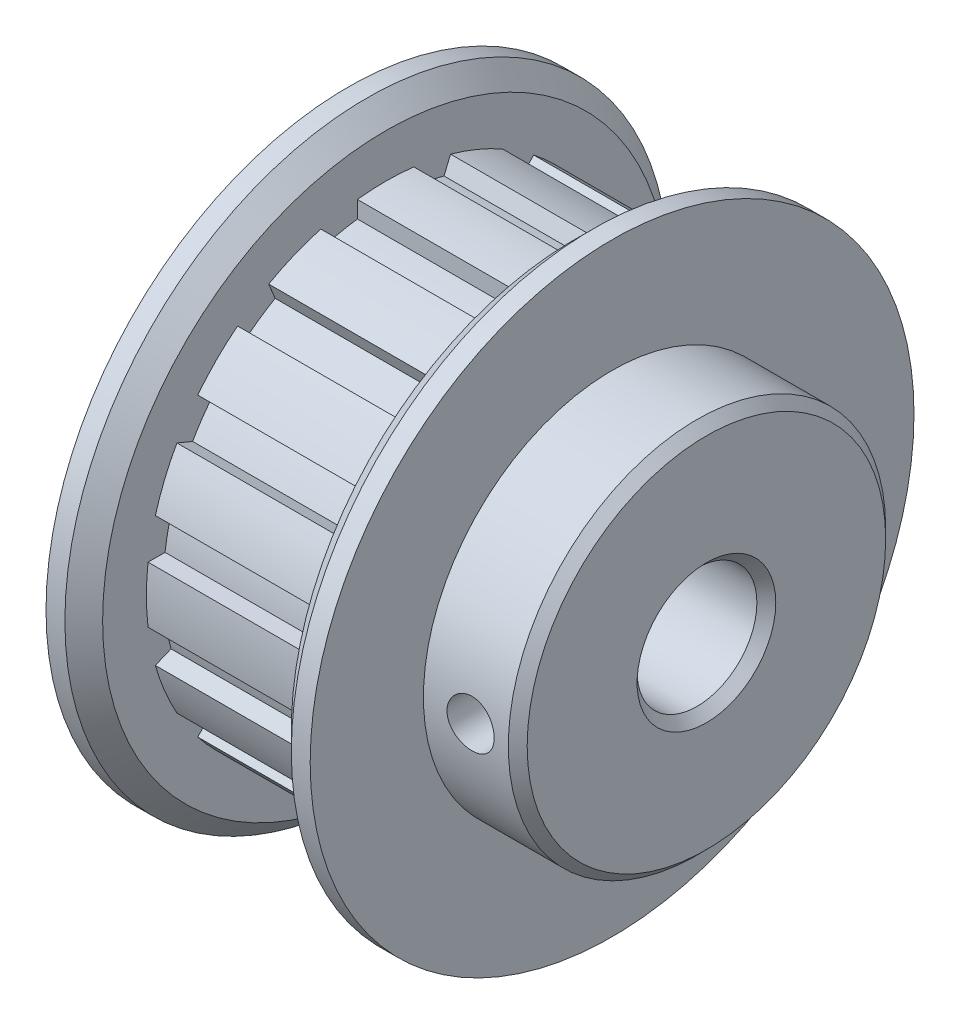
from build123d import *

# Parameters (mm, degrees)
BOSS_EXTRUDE1_START       = -13
BOSS_EXTRUDE1_DEPTH       = 14
BOSS_EXTRUDE1_START_2     = -25
BOSS_EXTRUDE1_2_OUTLINE_R = 9
BOSS_EXTRUDE1_2_DEPTH     = 12
BOSS_EXTRUDE1_START_3     = -1
BOSS_EXTRUDE1_3_OUTLINE_R = 16
BOSS_EXTRUDE1_3_DEPTH     = 2
BOSS_EXTRUDE1_4_OUTLINE_R = 14.25
BOSS_EXTRUDE1_4_DEPTH     = 0.9999999
SKETCH2_R                 = 9
CUT_EXTRUDE1_DEPTH        = 7
SKETCH3_R                 = 10
BOSS_EXTRUDE2_DEPTH       = 5
SKETCH8_R                 = 16
BOSS_EXTRUDE3_DEPTH       = 2
CHAMFER1_SIZE             = 1
SKETCH4_R                 = 3.175
CUT_EXTRUDE2_DEPTH        = 30.546573405
CHAMFER2_SIZE             = 0.5
SKETCH7_W                 = 1.25
SKETCH7_H                 = 16


with BuildPart() as part:
    # Boss-Extrude1: read off the stored shape, not the designer's step
    # Boss-Extrude1 outline → Boss-Extrude1 (new body)
    with BuildSketch(Plane.ZY.offset(BOSS_EXTRUDE1_START)):
        with BuildLine():
            ThreePointArc((-1.493827307, 11.692460658), (-2.299627171, 11.561006493), (-3.094394503, 11.374088047))
            Line((-3.094394503, 11.374088047), (-3.438518062, 12.20487581))
            ThreePointArc((-3.438518062, 12.20487581), (-4.852425922, 11.714792472), (-6.19875101, 11.061549888))
            Line((-6.19875101, 11.061549888), (-5.854627451, 10.230762125))
            ThreePointArc((-5.854627451, 10.230762125), (-6.548784122, 9.800948055), (-7.211522801, 9.324113638))
            Line((-7.211522801, 9.324113638), (-7.847380226, 9.959971063))
            ThreePointArc((-7.847380226, 9.959971063), (-8.966113985, 8.966113985), (-9.959971063, 7.847380226))
            Line((-9.959971063, 7.847380226), (-9.324113638, 7.211522801))
            ThreePointArc((-9.324113638, 7.211522801), (-9.800948055, 6.548784122), (-10.230762125, 5.854627451))
            Line((-10.230762125, 5.854627451), (-11.061549888, 6.19875101))
            ThreePointArc((-11.061549888, 6.19875101), (-11.714792472, 4.852425922), (-12.20487581, 3.438518062))
            Line((-12.20487581, 3.438518062), (-11.374088047, 3.094394503))
            ThreePointArc((-11.374088047, 3.094394503), (-11.561006493, 2.299627171), (-11.692460658, 1.493827307))
            Line((-11.692460658, 1.493827307), (-12.591698852, 1.493827307))
            ThreePointArc((-12.591698852, 1.493827307), (-12.68, 0), (-12.591698852, -1.493827307))
            Line((-12.591698852, -1.493827307), (-11.692460658, -1.493827307))
            ThreePointArc((-11.692460658, -1.493827307), (-11.561006493, -2.299627171), (-11.374088047, -3.094394503))
            Line((-11.374088047, -3.094394503), (-12.20487581, -3.438518062))
            ThreePointArc((-12.20487581, -3.438518062), (-11.714792472, -4.852425922), (-11.061549888, -6.19875101))
            Line((-11.061549888, -6.19875101), (-10.230762125, -5.854627451))
            ThreePointArc((-10.230762125, -5.854627451), (-9.800948055, -6.548784122), (-9.324113638, -7.211522801))
            Line((-9.324113638, -7.211522801), (-9.959971063, -7.847380226))
            ThreePointArc((-9.959971063, -7.847380226), (-8.966113985, -8.966113985), (-7.847380226, -9.959971063))
            Line((-7.847380226, -9.959971063), (-7.211522801, -9.324113638))
            ThreePointArc((-7.211522801, -9.324113638), (-6.548784122, -9.800948055), (-5.854627451, -10.230762125))
            Line((-5.854627451, -10.230762125), (-6.19875101, -11.061549888))
            ThreePointArc((-6.19875101, -11.061549888), (-4.852425922, -11.714792472), (-3.438518062, -12.20487581))
            Line((-3.438518062, -12.20487581), (-3.094394503, -11.374088047))
            ThreePointArc((-3.094394503, -11.374088047), (-2.299627171, -11.561006493), (-1.493827307, -11.692460658))
            Line((-1.493827307, -11.692460658), (-1.493827307, -12.591698852))
            ThreePointArc((-1.493827307, -12.591698852), (0, -12.68), (1.493827307, -12.591698852))
            Line((1.493827307, -12.591698852), (1.493827307, -11.692460658))
            ThreePointArc((1.493827307, -11.692460658), (2.299627171, -11.561006493), (3.094394503, -11.374088047))
            Line((3.094394503, -11.374088047), (3.438518062, -12.20487581))
            ThreePointArc((3.438518062, -12.20487581), (4.852425922, -11.714792472), (6.19875101, -11.061549888))
            Line((6.19875101, -11.061549888), (5.854627451, -10.230762125))
            ThreePointArc((5.854627451, -10.230762125), (6.548784122, -9.800948055), (7.211522801, -9.324113638))
            Line((7.211522801, -9.324113638), (7.847380226, -9.959971063))
            ThreePointArc((7.847380226, -9.959971063), (8.966113985, -8.966113985), (9.959971063, -7.847380226))
            Line((9.959971063, -7.847380226), (9.324113638, -7.211522801))
            ThreePointArc((9.324113638, -7.211522801), (9.800948055, -6.548784122), (10.230762125, -5.854627451))
            Line((10.230762125, -5.854627451), (11.061549888, -6.19875101))
            ThreePointArc((11.061549888, -6.19875101), (11.714792472, -4.852425922), (12.20487581, -3.438518062))
            Line((12.20487581, -3.438518062), (11.374088047, -3.094394503))
            ThreePointArc((11.374088047, -3.094394503), (11.561006493, -2.299627171), (11.692460658, -1.493827307))
            Line((11.692460658, -1.493827307), (12.591698852, -1.493827307))
            ThreePointArc((12.591698852, -1.493827307), (12.68, 0), (12.591698852, 1.493827307))
            Line((12.591698852, 1.493827307), (11.692460658, 1.493827307))
            ThreePointArc((11.692460658, 1.493827307), (11.561006493, 2.299627171), (11.374088047, 3.094394503))
            Line((11.374088047, 3.094394503), (12.20487581, 3.438518062))
            ThreePointArc((12.20487581, 3.438518062), (11.714792472, 4.852425922), (11.061549888, 6.19875101))
            Line((11.061549888, 6.19875101), (10.230762125, 5.854627451))
            ThreePointArc((10.230762125, 5.854627451), (9.800948055, 6.548784122), (9.324113638, 7.211522801))
            Line((9.324113638, 7.211522801), (9.959971063, 7.847380226))
            ThreePointArc((9.959971063, 7.847380226), (8.966113985, 8.966113985), (7.847380226, 9.959971063))
            Line((7.847380226, 9.959971063), (7.211522801, 9.324113638))
            ThreePointArc((7.211522801, 9.324113638), (6.548784122, 9.800948055), (5.854627451, 10.230762125))
            Line((5.854627451, 10.230762125), (6.19875101, 11.061549888))
            ThreePointArc((6.19875101, 11.061549888), (4.852425922, 11.714792472), (3.438518062, 12.20487581))
            Line((3.438518062, 12.20487581), (3.094394503, 11.374088047))
            ThreePointArc((3.094394503, 11.374088047), (2.299627171, 11.561006493), (1.493827307, 11.692460658))
            Line((1.493827307, 11.692460658), (1.493827307, 12.591698852))
            ThreePointArc((1.493827307, 12.591698852), (0, 12.68), (-1.493827307, 12.591698852))
            Line((-1.493827307, 12.591698852), (-1.493827307, 11.692460658))
        make_face()
    extrude(amount=BOSS_EXTRUDE1_DEPTH)

    # Boss-Extrude1 2 outline → Boss-Extrude1 2 (add)
    with BuildSketch(Plane.ZY.offset(BOSS_EXTRUDE1_START_2)):
        Circle(BOSS_EXTRUDE1_2_OUTLINE_R)
    extrude(amount=BOSS_EXTRUDE1_2_DEPTH)

    # Boss-Extrude1 3 outline → Boss-Extrude1 3 (add)
    with BuildSketch(Plane.ZY.offset(BOSS_EXTRUDE1_START_3)):
        Circle(BOSS_EXTRUDE1_3_OUTLINE_R)
        with BuildLine():
            Line((-3.438518062, 12.20487581), (-3.094394503, 11.374088047))
            ThreePointArc((-3.094394503, 11.374088047), (-2.299627171, 11.561006493), (-1.493827307, 11.692460658))
            Line((-1.493827307, 11.692460658), (-1.493827307, 12.591698852))
            ThreePointArc((-1.493827307, 12.591698852), (0, 12.68), (1.493827307, 12.591698852))
            Line((1.493827307, 12.591698852), (1.493827307, 11.692460658))
            ThreePointArc((1.493827307, 11.692460658), (2.299627171, 11.561006493), (3.094394503, 11.374088047))
            Line((3.094394503, 11.374088047), (3.438518062, 12.20487581))
            ThreePointArc((3.438518062, 12.20487581), (4.852425922, 11.714792472), (6.19875101, 11.061549888))
            Line((6.19875101, 11.061549888), (5.854627451, 10.230762125))
            ThreePointArc((5.854627451, 10.230762125), (6.548784122, 9.800948055), (7.211522801, 9.324113638))
            Line((7.211522801, 9.324113638), (7.847380226, 9.959971063))
            ThreePointArc((7.847380226, 9.959971063), (8.966113985, 8.966113985), (9.959971063, 7.847380226))
            Line((9.959971063, 7.847380226), (9.324113638, 7.211522801))
            ThreePointArc((9.324113638, 7.211522801), (9.800948055, 6.548784122), (10.230762125, 5.854627451))
            Line((10.230762125, 5.854627451), (11.061549888, 6.19875101))
            ThreePointArc((11.061549888, 6.19875101), (11.714792472, 4.852425922), (12.20487581, 3.438518062))
            Line((12.20487581, 3.438518062), (11.374088047, 3.094394503))
            ThreePointArc((11.374088047, 3.094394503), (11.561006493, 2.299627171), (11.692460658, 1.493827307))
            Line((11.692460658, 1.493827307), (12.591698852, 1.493827307))
            ThreePointArc((12.591698852, 1.493827307), (12.68, 0), (12.591698852, -1.493827307))
            Line((12.591698852, -1.493827307), (11.692460658, -1.493827307))
            ThreePointArc((11.692460658, -1.493827307), (11.561006493, -2.299627171), (11.374088047, -3.094394503))
            Line((11.374088047, -3.094394503), (12.20487581, -3.438518062))
            ThreePointArc((12.20487581, -3.438518062), (11.714792472, -4.852425922), (11.061549888, -6.19875101))
            Line((11.061549888, -6.19875101), (10.230762125, -5.854627451))
            ThreePointArc((10.230762125, -5.854627451), (9.800948055, -6.548784122), (9.324113638, -7.211522801))
            Line((9.324113638, -7.211522801), (9.959971063, -7.847380226))
            ThreePointArc((9.959971063, -7.847380226), (8.966113985, -8.966113985), (7.847380226, -9.959971063))
            Line((7.847380226, -9.959971063), (7.211522801, -9.324113638))
            ThreePointArc((7.211522801, -9.324113638), (6.548784122, -9.800948055), (5.854627451, -10.230762125))
            Line((5.854627451, -10.230762125), (6.19875101, -11.061549888))
            ThreePointArc((6.19875101, -11.061549888), (4.852425922, -11.714792472), (3.438518062, -12.20487581))
            Line((3.438518062, -12.20487581), (3.094394503, -11.374088047))
            ThreePointArc((3.094394503, -11.374088047), (2.299627171, -11.561006493), (1.493827307, -11.692460658))
            Line((1.493827307, -11.692460658), (1.493827307, -12.591698852))
            ThreePointArc((1.493827307, -12.591698852), (0, -12.68), (-1.493827307, -12.591698852))
            Line((-1.493827307, -12.591698852), (-1.493827307, -11.692460658))
            ThreePointArc((-1.493827307, -11.692460658), (-2.299627171, -11.561006493), (-3.094394503, -11.374088047))
            Line((-3.094394503, -11.374088047), (-3.438518062, -12.20487581))
            ThreePointArc((-3.438518062, -12.20487581), (-4.852425922, -11.714792472), (-6.19875101, -11.061549888))
            Line((-6.19875101, -11.061549888), (-5.854627451, -10.230762125))
            ThreePointArc((-5.854627451, -10.230762125), (-6.548784122, -9.800948055), (-7.211522801, -9.324113638))
            Line((-7.211522801, -9.324113638), (-7.847380226, -9.959971063))
            ThreePointArc((-7.847380226, -9.959971063), (-8.966113985, -8.966113985), (-9.959971063, -7.847380226))
            Line((-9.959971063, -7.847380226), (-9.324113638, -7.211522801))
            ThreePointArc((-9.324113638, -7.211522801), (-9.800948055, -6.548784122), (-10.230762125, -5.854627451))
            Line((-10.230762125, -5.854627451), (-11.061549888, -6.19875101))
            ThreePointArc((-11.061549888, -6.19875101), (-11.714792472, -4.852425922), (-12.20487581, -3.438518062))
            Line((-12.20487581, -3.438518062), (-11.374088047, -3.094394503))
            ThreePointArc((-11.374088047, -3.094394503), (-11.561006493, -2.299627171), (-11.692460658, -1.493827307))
            Line((-11.692460658, -1.493827307), (-12.591698852, -1.493827307))
            ThreePointArc((-12.591698852, -1.493827307), (-12.68, 0), (-12.591698852, 1.493827307))
            Line((-12.591698852, 1.493827307), (-11.692460658, 1.493827307))
            ThreePointArc((-11.692460658, 1.493827307), (-11.561006493, 2.299627171), (-11.374088047, 3.094394503))
            Line((-11.374088047, 3.094394503), (-12.20487581, 3.438518062))
            ThreePointArc((-12.20487581, 3.438518062), (-11.714792472, 4.852425922), (-11.061549888, 6.19875101))
            Line((-11.061549888, 6.19875101), (-10.230762125, 5.854627451))
            ThreePointArc((-10.230762125, 5.854627451), (-9.800948055, 6.548784122), (-9.324113638, 7.211522801))
            Line((-9.324113638, 7.211522801), (-9.959971063, 7.847380226))
            ThreePointArc((-9.959971063, 7.847380226), (-8.966113985, 8.966113985), (-7.847380226, 9.959971063))
            Line((-7.847380226, 9.959971063), (-7.211522801, 9.324113638))
            ThreePointArc((-7.211522801, 9.324113638), (-6.548784122, 9.800948055), (-5.854627451, 10.230762125))
            Line((-5.854627451, 10.230762125), (-6.19875101, 11.061549888))
            ThreePointArc((-6.19875101, 11.061549888), (-4.852425922, 11.714792472), (-3.438518062, 12.20487581))
        make_face(mode=Mode.SUBTRACT)
    extrude(amount=BOSS_EXTRUDE1_3_DEPTH)

    # Boss-Extrude1 4 outline → Boss-Extrude1 4 (add)
    with BuildSketch(Plane.ZY.offset(BOSS_EXTRUDE1_START)):
        Circle(BOSS_EXTRUDE1_4_OUTLINE_R)
        with BuildLine():
            Line((-3.438518062, 12.20487581), (-3.094394503, 11.374088047))
            ThreePointArc((-3.094394503, 11.374088047), (-2.299627171, 11.561006493), (-1.493827307, 11.692460658))
            Line((-1.493827307, 11.692460658), (-1.493827307, 12.591698852))
            ThreePointArc((-1.493827307, 12.591698852), (0, 12.68), (1.493827307, 12.591698852))
            Line((1.493827307, 12.591698852), (1.493827307, 11.692460658))
            ThreePointArc((1.493827307, 11.692460658), (2.299627171, 11.561006493), (3.094394503, 11.374088047))
            Line((3.094394503, 11.374088047), (3.438518062, 12.20487581))
            ThreePointArc((3.438518062, 12.20487581), (4.852425922, 11.714792472), (6.19875101, 11.061549888))
            Line((6.19875101, 11.061549888), (5.854627451, 10.230762125))
            ThreePointArc((5.854627451, 10.230762125), (6.548784122, 9.800948055), (7.211522801, 9.324113638))
            Line((7.211522801, 9.324113638), (7.847380226, 9.959971063))
            ThreePointArc((7.847380226, 9.959971063), (8.966113985, 8.966113985), (9.959971063, 7.847380226))
            Line((9.959971063, 7.847380226), (9.324113638, 7.211522801))
            ThreePointArc((9.324113638, 7.211522801), (9.800948055, 6.548784122), (10.230762125, 5.854627451))
            Line((10.230762125, 5.854627451), (11.061549888, 6.19875101))
            ThreePointArc((11.061549888, 6.19875101), (11.714792472, 4.852425922), (12.20487581, 3.438518062))
            Line((12.20487581, 3.438518062), (11.374088047, 3.094394503))
            ThreePointArc((11.374088047, 3.094394503), (11.561006493, 2.299627171), (11.692460658, 1.493827307))
            Line((11.692460658, 1.493827307), (12.591698852, 1.493827307))
            ThreePointArc((12.591698852, 1.493827307), (12.68, 0), (12.591698852, -1.493827307))
            Line((12.591698852, -1.493827307), (11.692460658, -1.493827307))
            ThreePointArc((11.692460658, -1.493827307), (11.561006493, -2.299627171), (11.374088047, -3.094394503))
            Line((11.374088047, -3.094394503), (12.20487581, -3.438518062))
            ThreePointArc((12.20487581, -3.438518062), (11.714792472, -4.852425922), (11.061549888, -6.19875101))
            Line((11.061549888, -6.19875101), (10.230762125, -5.854627451))
            ThreePointArc((10.230762125, -5.854627451), (9.800948055, -6.548784122), (9.324113638, -7.211522801))
            Line((9.324113638, -7.211522801), (9.959971063, -7.847380226))
            ThreePointArc((9.959971063, -7.847380226), (8.966113985, -8.966113985), (7.847380226, -9.959971063))
            Line((7.847380226, -9.959971063), (7.211522801, -9.324113638))
            ThreePointArc((7.211522801, -9.324113638), (6.548784122, -9.800948055), (5.854627451, -10.230762125))
            Line((5.854627451, -10.230762125), (6.19875101, -11.061549888))
            ThreePointArc((6.19875101, -11.061549888), (4.852425922, -11.714792472), (3.438518062, -12.20487581))
            Line((3.438518062, -12.20487581), (3.094394503, -11.374088047))
            ThreePointArc((3.094394503, -11.374088047), (2.299627171, -11.561006493), (1.493827307, -11.692460658))
            Line((1.493827307, -11.692460658), (1.493827307, -12.591698852))
            ThreePointArc((1.493827307, -12.591698852), (0, -12.68), (-1.493827307, -12.591698852))
            Line((-1.493827307, -12.591698852), (-1.493827307, -11.692460658))
            ThreePointArc((-1.493827307, -11.692460658), (-2.299627171, -11.561006493), (-3.094394503, -11.374088047))
            Line((-3.094394503, -11.374088047), (-3.438518062, -12.20487581))
            ThreePointArc((-3.438518062, -12.20487581), (-4.852425922, -11.714792472), (-6.19875101, -11.061549888))
            Line((-6.19875101, -11.061549888), (-5.854627451, -10.230762125))
            ThreePointArc((-5.854627451, -10.230762125), (-6.548784122, -9.800948055), (-7.211522801, -9.324113638))
            Line((-7.211522801, -9.324113638), (-7.847380226, -9.959971063))
            ThreePointArc((-7.847380226, -9.959971063), (-8.966113985, -8.966113985), (-9.959971063, -7.847380226))
            Line((-9.959971063, -7.847380226), (-9.324113638, -7.211522801))
            ThreePointArc((-9.324113638, -7.211522801), (-9.800948055, -6.548784122), (-10.230762125, -5.854627451))
            Line((-10.230762125, -5.854627451), (-11.061549888, -6.19875101))
            ThreePointArc((-11.061549888, -6.19875101), (-11.714792472, -4.852425922), (-12.20487581, -3.438518062))
            Line((-12.20487581, -3.438518062), (-11.374088047, -3.094394503))
            ThreePointArc((-11.374088047, -3.094394503), (-11.561006493, -2.299627171), (-11.692460658, -1.493827307))
            Line((-11.692460658, -1.493827307), (-12.591698852, -1.493827307))
            ThreePointArc((-12.591698852, -1.493827307), (-12.68, 0), (-12.591698852, 1.493827307))
            Line((-12.591698852, 1.493827307), (-11.692460658, 1.493827307))
            ThreePointArc((-11.692460658, 1.493827307), (-11.561006493, 2.299627171), (-11.374088047, 3.094394503))
            Line((-11.374088047, 3.094394503), (-12.20487581, 3.438518062))
            ThreePointArc((-12.20487581, 3.438518062), (-11.714792472, 4.852425922), (-11.061549888, 6.19875101))
            Line((-11.061549888, 6.19875101), (-10.230762125, 5.854627451))
            ThreePointArc((-10.230762125, 5.854627451), (-9.800948055, 6.548784122), (-9.324113638, 7.211522801))
            Line((-9.324113638, 7.211522801), (-9.959971063, 7.847380226))
            ThreePointArc((-9.959971063, 7.847380226), (-8.966113985, 8.966113985), (-7.847380226, 9.959971063))
            Line((-7.847380226, 9.959971063), (-7.211522801, 9.324113638))
            ThreePointArc((-7.211522801, 9.324113638), (-6.548784122, 9.800948055), (-5.854627451, 10.230762125))
            Line((-5.854627451, 10.230762125), (-6.19875101, 11.061549888))
            ThreePointArc((-6.19875101, 11.061549888), (-4.852425922, 11.714792472), (-3.438518062, 12.20487581))
        make_face(mode=Mode.SUBTRACT)
    extrude(amount=BOSS_EXTRUDE1_4_DEPTH)

    # Boss-Extrude1 5 outline → Boss-Extrude1 5 (revolve)
    with BuildSketch(Plane.YX):
        Polygon((11.7875, 12.0000001), (11.7875, 11), (13.25, 11), (14.25, 12), align=None)
    revolve(axis=Axis((0, 0, 0), (1, 0, 0)))

    # Sketch2 → Cut-Extrude1 (cut)
    with BuildSketch(Plane(origin=(25, 0, 0), x_dir=(0, 0, -1), z_dir=(1, 0, 0))):
        Circle(SKETCH2_R)
    extrude(amount=-CUT_EXTRUDE1_DEPTH, mode=Mode.SUBTRACT)

    # Sketch3 → Boss-Extrude2 (add)
    with BuildSketch(Plane(origin=(18, 0, 0), x_dir=(0, 0, -1), z_dir=(1, 0, 0))):
        Circle(SKETCH3_R)
    extrude(amount=-BOSS_EXTRUDE2_DEPTH)

    # Sketch8 → Boss-Extrude3 (add)
    with BuildSketch(Plane(origin=(13, 0, 0), x_dir=(0, 0, -1), z_dir=(1, 0, 0))):
        with Locations(Location((0, 0, 0), (0, 0, 180))):
            Circle(SKETCH8_R)
    extrude(amount=-BOSS_EXTRUDE3_DEPTH)

    # Chamfer1
    chamfer1_edges = [part.edges().sort_by_distance(p)[0] for p in [
        (1, 0, -16),
        (11, 0, -16),
    ]]
    chamfer(chamfer1_edges, length=CHAMFER1_SIZE)

    # Sketch4 → Cut-Extrude2 (cut, through all)
    with BuildSketch(Plane(origin=(18, 0, 0), x_dir=(0, 0, -1), z_dir=(1, 0, 0))):
        Circle(SKETCH4_R)
    extrude(amount=-CUT_EXTRUDE2_DEPTH, mode=Mode.SUBTRACT)

    # Chamfer2
    chamfer2_edges = [part.edges().sort_by_distance(p)[0] for p in [
        (18, 0, 10),
        (-1, 0, 3.175),
        (18, 0, 3.175),
    ]]
    chamfer(chamfer2_edges, length=CHAMFER2_SIZE)

    # Sketch7 → Tap Drill for M3 Tap1 (revolve, cut)
    with BuildSketch(Plane.YZ.offset(15.5)):
        with Locations((0.625, 8)):
            Rectangle(SKETCH7_W, SKETCH7_H)
    revolve(axis=Axis((15.5, 0, -6.35), (0, 0, 1)), mode=Mode.SUBTRACT)


solid = part.part
